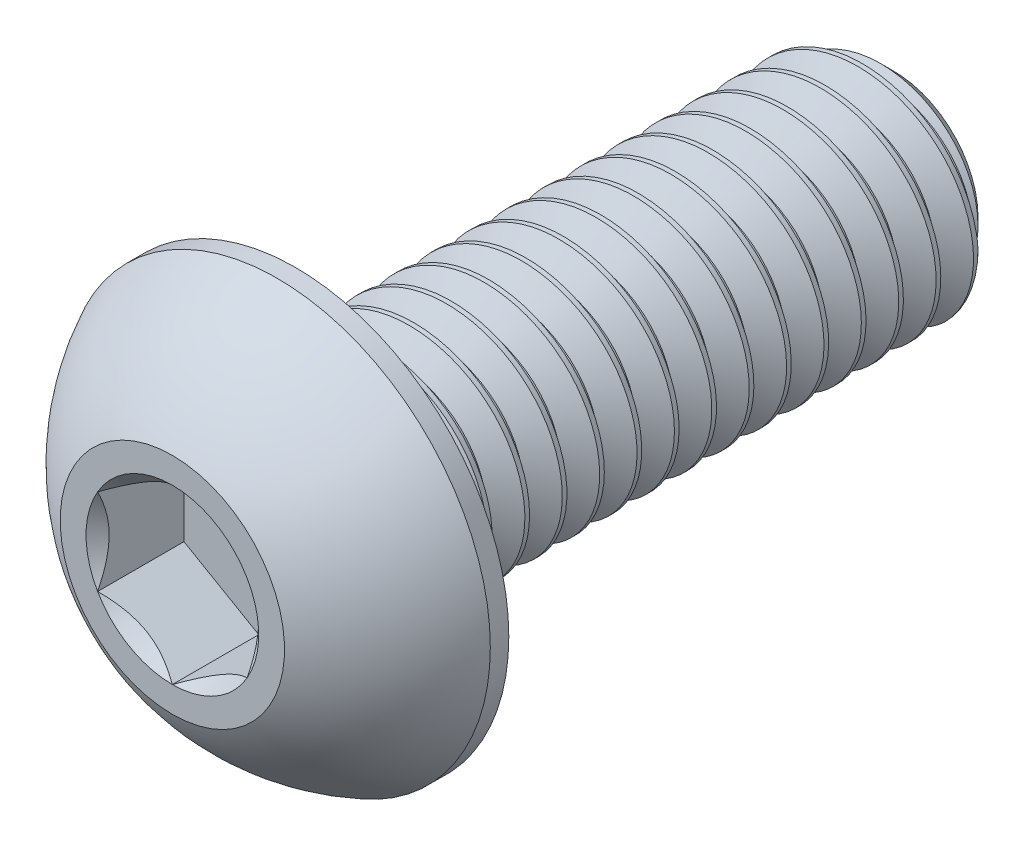
from build123d import *

# Parameters (mm, degrees)
CUT_EXTRUDE2_DEPTH = 1.155
CUT_SWEEP2_PITCH   = 0.5


# Read off the part's stored shape, not the designer's step: Split1, Boss-Extrude1
with BuildPart() as part:
    # Sketch10 → Revolve3 (revolve)
    with BuildSketch(Plane(origin=(0, 0, 0), x_dir=(0, 0, -1), z_dir=(1, 0, 0)), mode=Mode.PRIVATE) as revolve3_sk:
        Polygon((9.275, 1.5), (9.65, 1.125), (9.65, 0), (1.65, 0), (1.65, 1.5), align=None)
    revolve(revolve3_sk.sketch.rotate(Axis((0, 0, 0), (0, 0, -1)), 90), axis=Axis((0, 0, 0), (0, 0, -1)))

    # Sketch7 → Revolve2 (revolve)
    with BuildSketch(Plane(origin=(0, 0, 0), x_dir=(0, 0, -1), z_dir=(1, 0, 0)), mode=Mode.PRIVATE) as revolve2_sk:
        with BuildLine():
            Line((1.4025, 2.85), (1.65, 2.85))
            Line((1.65, 2.85), (1.65, 0))
            Line((1.65, 0), (0, 0))
            Line((0, 0), (0, 1.5))
            ThreePointArc((0, 1.5), (0.59512511, 2.285251969), (1.4025, 2.85))
        make_face()
    revolve(revolve2_sk.sketch.rotate(Axis((0, 0, 0), (0, 0, -1)), 180), axis=Axis((0, 0, 0), (0, 0, -1)))

    # Sketch5 → Cut-Extrude2 (cut)
    with BuildSketch(Plane.XY):
        Polygon((1, -0.577350269), (1, 0.577350269), (0, 1.154700538), (-1, 0.577350269), (-1, -0.577350269), (0, -1.154700538), align=None)
    extrude(amount=-CUT_EXTRUDE2_DEPTH, mode=Mode.SUBTRACT)

    # Cut-Extrude3 cone 1 section (through the dimple's axis) → Cut-Extrude3 (revolve, cut)
    with BuildSketch(Plane(origin=(0, 0, 0), x_dir=(0, -1, 0), z_dir=(1, 0, 0))):
        Polygon((0, 0), (1.154700538, 0), (0, 1.154700538), align=None)
    revolve(axis=Axis((0, 0, 0), (0, 0, -1)), mode=Mode.SUBTRACT)


with BuildPart() as body_2:
    # Split1: the piece on the far side of the plane
    add(part.part)
    split(bisect_by=Plane.XY.offset(-1.65), keep=Keep.BOTTOM)

    # Cut-Sweep2: the profile of Sketch12 screwed along a right-hand helix of 19.3 turns, 6 arcs to a turn; built about Z, then put on its axis
    cut_sweep2_z = Axis((0, 0, 0), (0, 0, 1))
    cut_sweep2_corners = [(1.175240474, 0, -0.1875), (1.175240474, 0, -0.25), (1.527063294, 0, -0.453125), (1.527063294, 0, 0.015625)]
    with BuildLine(mode=Mode.PRIVATE) as cut_sweep2_profile:
        Line(cut_sweep2_corners[0], cut_sweep2_corners[1])
        Line(cut_sweep2_corners[1], cut_sweep2_corners[2])
        Line(cut_sweep2_corners[2], cut_sweep2_corners[3])
        Line(cut_sweep2_corners[3], cut_sweep2_corners[0])
    cut_sweep2_cap = Face(cut_sweep2_profile.wire())
    cut_sweep2_turn_angles = [0, 30, 60, 90, 120, 150, 180, 210, 240, 270, 300, 330, 360]
    cut_sweep2_turn_weights = [1, 0.8660254037844387, 1, 0.8660254037844387, 1, 0.8660254037844387, 1, 0.8660254037844387, 1, 0.8660254037844387, 1, 0.8660254037844387, 1]
    cut_sweep2_turn_rails = [Edge.make_bspline([Vector(p[0], p[1], 0).rotate(cut_sweep2_z, cut_sweep2_turn_angles[k]) / cut_sweep2_turn_weights[k] + Vector(0, 0, p[2] + CUT_SWEEP2_PITCH * cut_sweep2_turn_angles[k] / 360) for k in range(13)], [0, 0, 0, 1, 1, 2, 2, 3, 3, 4, 4, 5, 5, 6, 6, 6], 2, cut_sweep2_turn_weights) for p in cut_sweep2_corners]
    cut_sweep2_turn_sides = [Face.make_surface_from_curves(cut_sweep2_turn_rails[p[0]], cut_sweep2_turn_rails[p[1]]) for p in [(0, 1), (1, 2), (2, 3), (3, 0)]]
    cut_sweep2_turn = Solid(Shell([*cut_sweep2_turn_sides, cut_sweep2_cap, cut_sweep2_cap.rotate(cut_sweep2_z, 360).moved(Location((0, 0, CUT_SWEEP2_PITCH * 360 / 360)))]))
    cut_sweep2_last_angles = [6840, 6870, 6900, 6924, 6948]
    cut_sweep2_last_weights = [1, 0.8660254037844387, 1, 0.9135454576422749, 1]
    cut_sweep2_last_rails = [Edge.make_bspline([Vector(p[0], p[1], 0).rotate(cut_sweep2_z, cut_sweep2_last_angles[k]) / cut_sweep2_last_weights[k] + Vector(0, 0, p[2] + CUT_SWEEP2_PITCH * cut_sweep2_last_angles[k] / 360) for k in range(5)], [0, 0, 0, 1, 1, 2, 2, 2], 2, cut_sweep2_last_weights) for p in cut_sweep2_corners]
    cut_sweep2_last_sides = [Face.make_surface_from_curves(cut_sweep2_last_rails[p[0]], cut_sweep2_last_rails[p[1]]) for p in [(0, 1), (1, 2), (2, 3), (3, 0)]]
    cut_sweep2_last = Solid(Shell([*cut_sweep2_last_sides, cut_sweep2_cap.rotate(cut_sweep2_z, 6840).moved(Location((0, 0, CUT_SWEEP2_PITCH * 6840 / 360))), cut_sweep2_cap.rotate(cut_sweep2_z, 6948).moved(Location((0, 0, CUT_SWEEP2_PITCH * 6948 / 360)))]))
    cut_sweep2_each = [*[cut_sweep2_turn.moved(Location((0, 0, CUT_SWEEP2_PITCH * i))) for i in range(19)], cut_sweep2_last]
    add(Plane(origin=(0, 0, -9.65), x_dir=(0, 1, 0), z_dir=(0, 0, 1)) * Compound([cut_sweep2_each[i] for i in range(0, 20, 2)]), mode=Mode.SUBTRACT)
    add(Plane(origin=(0, 0, -9.65), x_dir=(0, 1, 0), z_dir=(0, 0, 1)) * Compound([cut_sweep2_each[i] for i in range(1, 20, 2)]), mode=Mode.SUBTRACT)


with BuildPart() as part_1:
    add(part.part)

    # Split1
    split(bisect_by=Plane.XY.offset(-1.65), keep=Keep.TOP)

    add(body_2.part)  # Boss-Extrude1 merges body 2
    # Boss-Extrude1 outline → Boss-Extrude1 (revolve)
    with BuildSketch(Plane.XZ):
        Polygon((1.175240474, -1.65), (1.175240474, -1.974759526), (1.5, -1.65), align=None)
    revolve(axis=Axis((0, 0, 0), (0, 0, 1)))


solid = part_1.part
